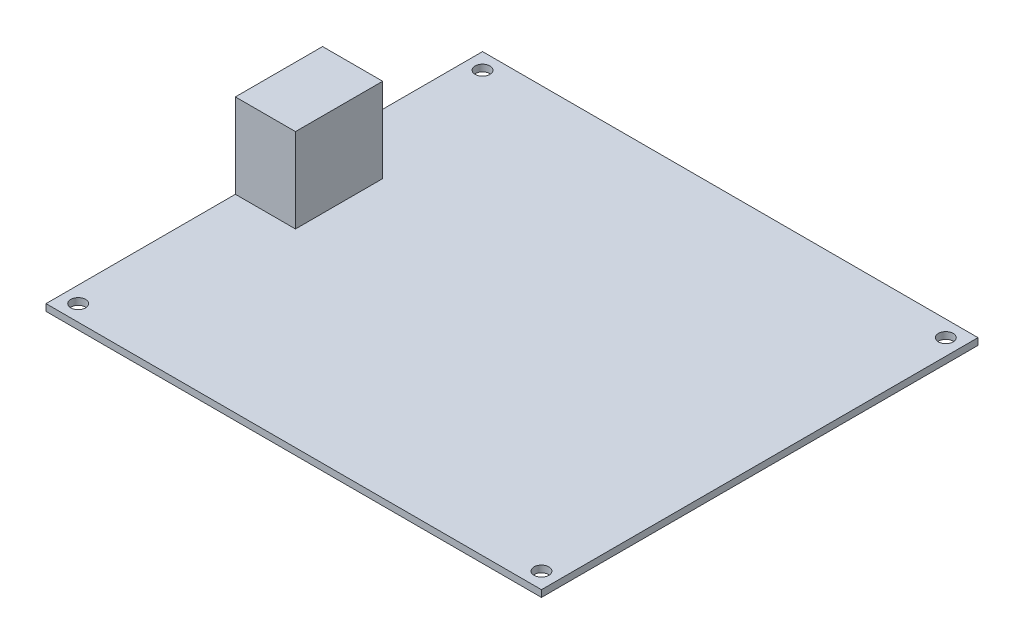
from build123d import *

# Parameters (mm, degrees)
SKETCH1_W           = 117.475
SKETCH1_H           = 103.505
SKETCH1_R           = 1.7526
BOSS_EXTRUDE1_DEPTH = 1.6
SKETCH2_W           = 14.25
SKETCH2_H           = 20.676
BOSS_EXTRUDE2_DEPTH = 20


with BuildPart() as part:
    # Sketch1 → Boss-Extrude1 (new body)
    with BuildSketch(Plane(origin=(0, 0, 0), x_dir=(1, 0, 0), z_dir=(0, 1, 0))):
        with Locations((58.7375, 51.7525)):
            Rectangle(SKETCH1_W, SKETCH1_H)
        with Locations((3.815, 3.815)):
            Circle(SKETCH1_R, mode=Mode.SUBTRACT)
        with Locations((113.66, 3.815)):
            Circle(SKETCH1_R, mode=Mode.SUBTRACT)
        with Locations((113.66, 99.69)):
            Circle(SKETCH1_R, mode=Mode.SUBTRACT)
        with Locations((3.815, 99.69)):
            Circle(SKETCH1_R, mode=Mode.SUBTRACT)
    extrude(amount=BOSS_EXTRUDE1_DEPTH)

    # Sketch2 → Boss-Extrude2 (add)
    with BuildSketch(Plane(origin=(0, 1.6, 0), x_dir=(1, 0, 0), z_dir=(0, 1, 0))):
        with Locations((7.125, 55.239)):
            Rectangle(SKETCH2_W, SKETCH2_H)
    extrude(amount=BOSS_EXTRUDE2_DEPTH)


solid = part.part
